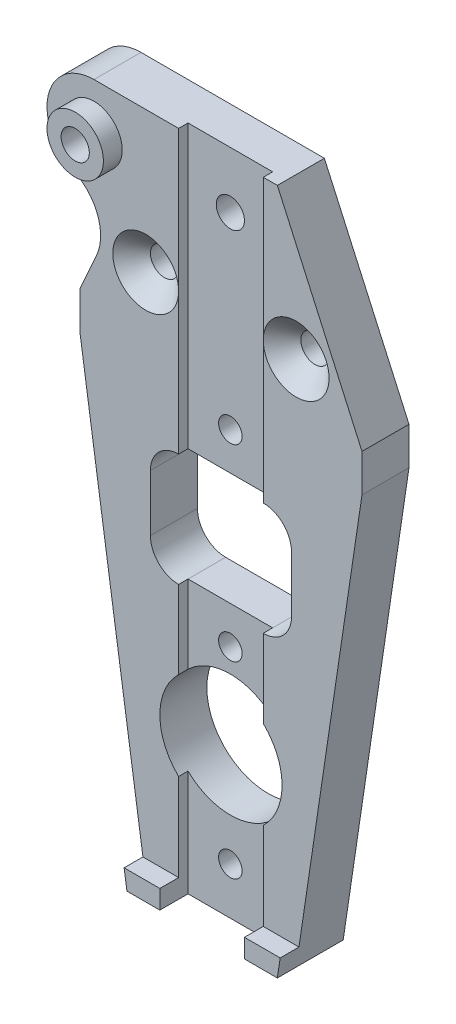
from build123d import *

# Parameters (mm, degrees)
SKETCH_1_R          = 6.5
SKETCH_1_R_2        = 1.5
SKETCH_1_W          = 15
SKETCH_1_H          = 12
EXTRUDE_1_DEPTH     = 5
HOLE_WIZARD_M3_1_D  = 2.5
SKETCH_2_W          = 9
SKETCH_2_H          = 83.78955867
CUT_EXTRUDE_1_DEPTH = 1
FILLET_1_R          = 3
EXTRUDE_2_DEPTH     = 2
CHAMFER_1_SIZE      = 2
SKETCH_5_R          = 1.5
EXTRUDE_4_DEPTH     = 5
FILLET_2_R          = 5
EXTRUDE_START       = 2
SKETCH_6_R          = 3
SKETCH_6_R_2        = 1.5
EXTRUDE_5_DEPTH     = 2


with BuildPart() as part:
    # 草图1 → 凸台-拉伸1 (new body)
    with BuildSketch(Plane.XY):
        Polygon((6, 55), (-6, 55), (-15, 35), (-15, 31), (-8, -16), (8, -16), (15, 31), (15, 35), align=None)
        Circle(SKETCH_1_R, mode=Mode.SUBTRACT)
        with Locations((0, 49)):
            Circle(SKETCH_1_R_2, mode=Mode.SUBTRACT)
        with Locations((-8, 40)):
            Circle(SKETCH_1_R_2, mode=Mode.SUBTRACT)
        with Locations(Location((8, 40, 0), (0, 0, 180))):
            Circle(SKETCH_1_R_2, mode=Mode.SUBTRACT)
        with Locations((0, 19)):
            Rectangle(SKETCH_1_W, SKETCH_1_H, mode=Mode.SUBTRACT)
    extrude(amount=EXTRUDE_1_DEPTH)

    # M3 螺纹孔1 (through all)
    with Locations(Plane.XY.offset(5)):
        with Locations((0, 29), (0, 9), (0, -11)):
            Hole(HOLE_WIZARD_M3_1_D / 2)

    # 草图2 → 切除-拉伸1 (cut)
    with BuildSketch(Plane.XY.offset(5)):
        with Locations((0, 22.915271632)):
            Rectangle(SKETCH_2_W, SKETCH_2_H)
    extrude(amount=-CUT_EXTRUDE_1_DEPTH, mode=Mode.SUBTRACT)

    # 圆角1
    fillet_1_edges = [part.edges().sort_by_distance(p)[0] for p in [
        (7.5, 13, 2.5),
        (-7.5, 13, 2.5),
        (-7.5, 25, 2.5),
        (7.5, 25, 2.5),
    ]]
    fillet(fillet_1_edges, radius=FILLET_1_R)

    # 草图4 → 凸台-拉伸2 (add)
    with BuildSketch(Plane.XY.offset(5)):
        Polygon((-8, -16), (-4.5, -16), (-4.5, -14), (-8.29787234, -14), align=None)
        Polygon((4.5, -14), (8.29787234, -14), (8, -16), (4.5, -16), align=None)
    extrude(amount=EXTRUDE_2_DEPTH)

    # 倒角1
    chamfer_1_edges = [part.edges().sort_by_distance(p)[0] for p in [
        (-9.5, 40, 5),
        (9.5, 40, 5),
    ]]
    chamfer(chamfer_1_edges, length=CHAMFER_1_SIZE - 0.0001)  # a hair under: the kernel refuses the full size

    # 草图5 → 凸台-拉伸4 (add)
    with BuildSketch(Plane.XY.offset(5)):
        with BuildLine():
            Line((6, 55), (13.5, 55))
            ThreePointArc((13.5, 55), (18.049597051, 47.926074574), (9.725789999, 46.720466669))
            Line((9.725789999, 46.720466669), (6, 55))
        make_face()
        with Locations((13.5, 50)):
            Circle(SKETCH_5_R, mode=Mode.SUBTRACT)
    extrude(amount=-EXTRUDE_4_DEPTH)

    # 圆角2
    fillet_2_edges = [part.edges().sort_by_distance(p)[0] for p in [
        (9.725789999, 46.720466669, 2.5),
    ]]
    fillet(fillet_2_edges, radius=FILLET_2_R)

    # 草图6 → 凸台-拉伸5 (add)
    with BuildSketch(Plane.XY.offset(5).offset(EXTRUDE_START)):
        with Locations((13.5, 50)):
            Circle(SKETCH_6_R)
        with Locations((13.5, 50)):
            Circle(SKETCH_6_R_2, mode=Mode.SUBTRACT)
    extrude(amount=-EXTRUDE_5_DEPTH)


with BuildPart() as body_2:
    # 镜向1: mirrored copy
    add(part.part.mirror(Plane(origin=(0, 0, 0), x_dir=(0, 0, 1), z_dir=(1, 0, 0))))


solid = body_2.part
